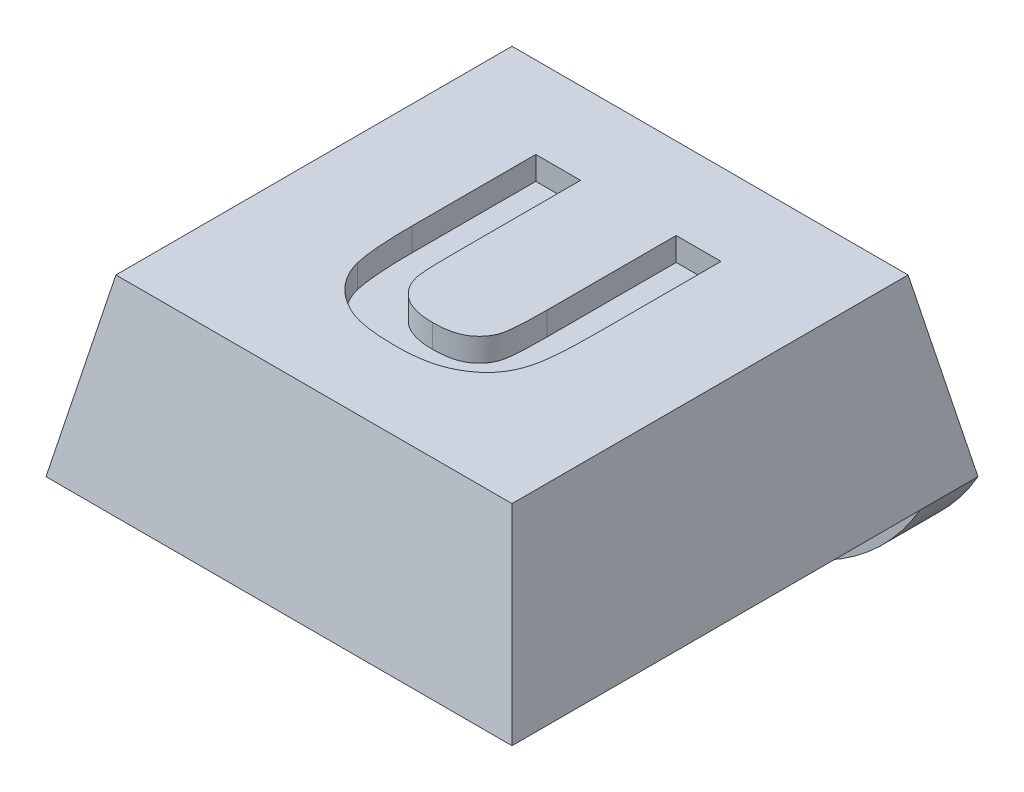
from build123d import *

# Parameters (mm, degrees)
SKETCH1_W               = 8
SKETCH1_H               = 8
BOSS_EXTRUDE1_DEPTH     = 3
CUT_EXTRUDE1_DEPTH      = 12.704699911
CUT_EXTRUDE1_DEPTH_BACK = 12.704699911
CUT_EXTRUDE2_DEPTH      = 11
SKETCH4_R               = 1.8
CUT_EXTRUDE3_DEPTH      = 0.8
SKETCH5_W               = 8
SKETCH5_H               = 1
BOSS_EXTRUDE2_DEPTH     = 2
FILLET1_R               = 4
CUT_EXTRUDE4_DEPTH      = 0.4


with BuildPart() as part:
    # Sketch1 → Boss-Extrude1 (new body)
    with BuildSketch(Plane(origin=(0, 0, 0), x_dir=(1, 0, 0), z_dir=(0, 1, 0))):
        with Locations((4, 4)):
            Rectangle(SKETCH1_W, SKETCH1_H)
    extrude(amount=BOSS_EXTRUDE1_DEPTH)

    # Sketch2 → Cut-Extrude1 (cut, two sides: drawn at the far end of the back side and taken through both)
    with BuildSketch(Plane.XY.offset(-CUT_EXTRUDE1_DEPTH_BACK)):
        Polygon((0, 0), (0.6, 3), (0, 3), align=None)
        Polygon((8, 0), (7.4, 3), (8, 3), align=None)
    extrude(amount=CUT_EXTRUDE1_DEPTH + CUT_EXTRUDE1_DEPTH_BACK, mode=Mode.SUBTRACT)

    # Sketch3 → Cut-Extrude2 (cut)
    with BuildSketch(Plane(origin=(0, 0, 0), x_dir=(0, 0, -1), z_dir=(1, 0, 0))):
        Polygon((0, 0), (0.6, 3), (0, 3), align=None)
        Polygon((8, 3), (7.4, 3), (8, 0), align=None)
    extrude(amount=CUT_EXTRUDE2_DEPTH, mode=Mode.SUBTRACT)

    # Sketch4 → Cut-Extrude3 (cut)
    with BuildSketch(Plane.XZ):
        with Locations(Location((4, -3.75, 0), (0, 0, 270))):
            Circle(SKETCH4_R)
    extrude(amount=-CUT_EXTRUDE3_DEPTH, mode=Mode.SUBTRACT)

    # Sketch5 → Boss-Extrude2 (add)
    with BuildSketch(Plane.XZ):
        with Locations((4, -7.5)):
            Rectangle(SKETCH5_W, SKETCH5_H)
    extrude(amount=BOSS_EXTRUDE2_DEPTH)

    # Fillet1
    # the kernel refuses this fillet: 4 mm, written as the material it takes off along each edge
    with BuildSketch(Plane(origin=(8, -2, -16.660254038), x_dir=(0, 1, 0), z_dir=(0, 0, 1)), Plane(origin=(0, -2, 1.660254038), x_dir=(0, 1, 0), z_dir=(0, 0, -1))) as fillet1_piece_1:
        with BuildLine():
            CenterArc((4, 3.464101615), FILLET1_R, 180, 60)
            Line((0, 3.464101615), (-0.08, 3.464101615))
            Line((-0.08, 3.464101615), (-0.08, 0))
            Line((-0.08, 0), (0, -0.08))
            ThreePointArc((0, -0.08), (1, -0.08), (1.96, -0.069282032))
            Line((1.96, -0.069282032), (2, 0))
        make_face()
    extrude(amount=18.320508076, mode=Mode.SUBTRACT)

    # Sketch6 → Cut-Extrude4 (cut)
    with BuildSketch(Plane(origin=(0, 3, 0), x_dir=(1, 0, 0), z_dir=(0, 1, 0))):
        with BuildLine():
            Line((2.413140262, 5.995145478), (3.182371031, 5.995145478))
            Line((3.182371031, 5.995145478), (3.182371031, 3.824472401))
            add(Edge.make_bspline(
                [(3.182371031, 3.824472401), (3.182664695, 3.783339968), (3.183225327, 3.704814249), (3.183611242, 3.59262518), (3.18574694, 3.491896749), (3.190378411, 3.402466647), (3.193557117, 3.32438048), (3.199459629, 3.257623918), (3.205347836, 3.202222959), (3.211072588, 3.16927001), (3.213621031, 3.154600607)],
                knots=[0, 0, 0, 0, 1.470600056, 2.807515117, 4.011048972, 5.072079398, 6.00911328, 6.804506435, 7.467811572, 8, 8, 8, 8], degree=3))
            add(Edge.make_bspline(
                [(3.213621031, 3.154600607), (3.224127628, 3.115054038), (3.244816443, 3.03718185), (3.301842427, 2.930732637), (3.377172946, 2.83690436), (3.454012852, 2.769989694), (3.523520467, 2.722632459), (3.582561491, 2.693810163), (3.645203631, 2.667536787), (3.712771176, 2.647377448), (3.784538951, 2.629737301), (3.861373833, 2.619537644), (3.942627383, 2.611709661), (3.998321517, 2.610930314), (4.026922313, 2.610530094)],
                knots=[0, 0, 0, 0, 1.376921055, 2.711331395, 4.038631339, 5.418057255, 6.132954575, 6.870556231, 7.630397752, 8.422890386, 9.247036838, 10.121396817, 11.035274583, 12, 12, 12, 12], degree=3))
            add(Edge.make_bspline(
                [(4.026922313, 2.610530094), (4.055777389, 2.611053435), (4.111957634, 2.612072369), (4.193372399, 2.618140476), (4.269330983, 2.629588903), (4.339786919, 2.644600001), (4.40511233, 2.663571514), (4.464786061, 2.687591678), (4.518714075, 2.716497769), (4.582078678, 2.760066391), (4.650258908, 2.821527538), (4.715873674, 2.905091818), (4.762833649, 2.997337694), (4.784859868, 3.081565077), (4.796180605, 3.154949811), (4.803077806, 3.219164001), (4.809385646, 3.291832182), (4.815113647, 3.372755319), (4.819030865, 3.461994153), (4.821149619, 3.559774375), (4.82281709, 3.666080391), (4.823198873, 3.739802878), (4.823396672, 3.777998042)],
                knots=[0, 0, 0, 0, 1.036876239, 2.018776863, 2.930845756, 3.794842666, 4.605604932, 5.371924355, 6.101864688, 6.799283669, 8.1310906, 9.382718023, 10.597336334, 11.822035891, 12.492591141, 13.265194674, 14.141890321, 15.11351293, 16.179860579, 17.351049011, 18.627594861, 20, 20, 20, 20], degree=3))
            Line((4.823396672, 3.777998042), (4.823396672, 5.995145478))
            Line((4.823396672, 5.995145478), (5.592627441, 5.995145478))
            Line((5.592627441, 5.995145478), (5.592627441, 3.902998042))
            add(Edge.make_bspline(
                [(5.592627441, 3.902998042), (5.592528847, 3.845305157), (5.592339402, 3.734449864), (5.589381475, 3.574956755), (5.583094941, 3.428628514), (5.577830511, 3.295214312), (5.567675642, 3.175054503), (5.557043529, 3.068074376), (5.543346947, 2.974292627), (5.523815493, 2.867696041), (5.490991615, 2.748101531), (5.438090809, 2.615994056), (5.370481989, 2.495804532), (5.288434562, 2.387071806), (5.192421188, 2.289363714), (5.081004269, 2.203064381), (4.955329501, 2.127124651), (4.84016309, 2.072443299), (4.739752735, 2.035622669), (4.65797018, 2.010704116), (4.570444093, 1.989952175), (4.477277128, 1.973483664), (4.378429252, 1.959598273), (4.273864574, 1.950325107), (4.163741291, 1.944537997), (4.088628699, 1.944091898), (4.050159493, 1.943863427)],
                knots=[0, 0, 0, 0, 1.415574045, 2.719986624, 3.913607924, 5.00929969, 5.995467356, 6.871900228, 7.64671288, 8.320227872, 9.530145585, 10.682614022, 11.803571353, 12.90325401, 14.015460715, 15.154679255, 16.351678057, 17.612271512, 18.275764165, 18.974412946, 19.708786676, 20.481351116, 21.295095879, 22.157200529, 23.056203067, 24, 24, 24, 24], degree=3))
            add(Edge.make_bspline(
                [(4.050159493, 1.943863427), (4.00394899, 1.944454117), (3.914432357, 1.945598373), (3.784491522, 1.950702797), (3.663419731, 1.961238523), (3.550836598, 1.975478544), (3.446788608, 1.993784557), (3.351012543, 2.015669281), (3.264273035, 2.043328483), (3.160959321, 2.082832512), (3.045798952, 2.143260432), (2.920442018, 2.223870786), (2.810400187, 2.314853884), (2.716640343, 2.415320705), (2.638260762, 2.521740618), (2.574552012, 2.631810814), (2.523497916, 2.743696672), (2.502164616, 2.821459533), (2.491665903, 2.859728812)],
                knots=[0, 0, 0, 0, 1.128613534, 2.186292659, 3.174878439, 4.095586888, 4.95671962, 5.754129884, 6.492676435, 7.178284149, 8.453103036, 9.659838108, 10.813193309, 11.929983019, 13.007587775, 14.033493319, 15.032227051, 16, 16, 16, 16], degree=3))
            add(Edge.make_bspline(
                [(2.491665903, 2.859728812), (2.48524032, 2.889857793), (2.471705989, 2.953319061), (2.456334745, 3.054210037), (2.442311642, 3.165307899), (2.432733679, 3.286744058), (2.423654648, 3.418133217), (2.417136225, 3.559723113), (2.414455843, 3.711481594), (2.413587623, 3.816192051), (2.413140262, 3.870145478)],
                knots=[0, 0, 0, 0, 0.728071598, 1.533551606, 2.411422299, 3.374601532, 4.412367648, 5.524718474, 6.72457895, 8, 8, 8, 8], degree=3))
            Line((2.413140262, 3.870145478), (2.413140262, 5.995145478))
        make_face()
    extrude(amount=-CUT_EXTRUDE4_DEPTH, mode=Mode.SUBTRACT)


solid = part.part
